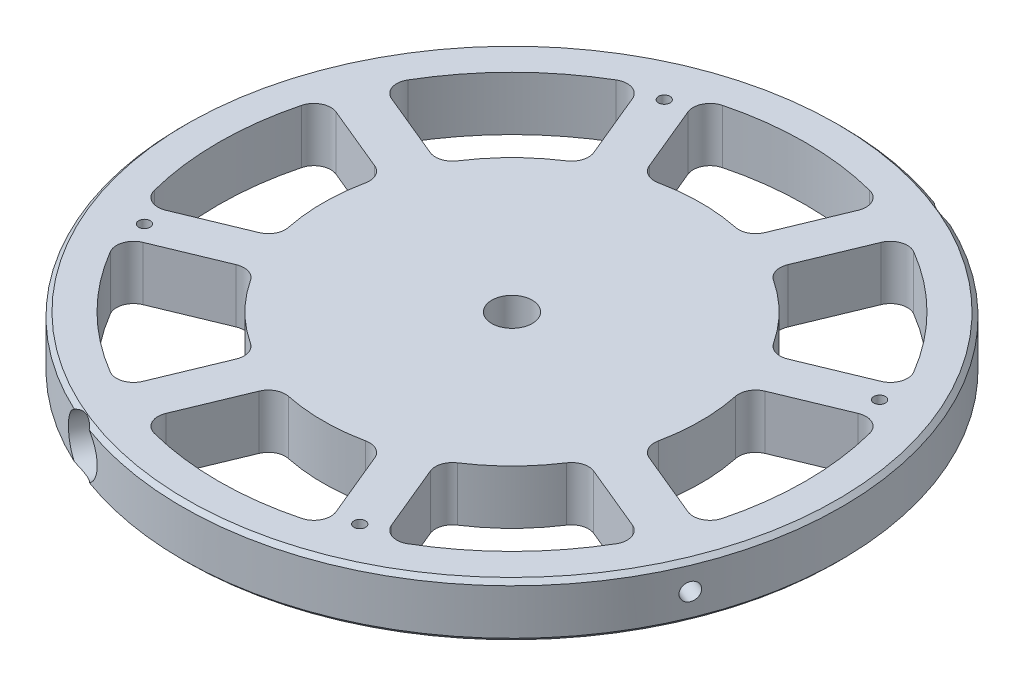
from build123d import *

# Parameters (mm, degrees)
SKETCH2_W                = 77.55
SKETCH2_H                = 12.7
F_6_32_TAPPED_HOLE2_D    = 2.7051
CIRPATTERN3_COUNT        = 4
CUT_EXTRUDE1_DEPTH       = 111.405140279
FILLET1_R                = 4
CIRPATTERN4_COUNT        = 8
FILLET1_OF_CIRPATTERN4_R = 4
CHAMFER1_SIZE            = 1
SKETCH15_W               = 2.0447
SKETCH15_H               = 101.323957926
SKETCH19_R               = 6.25
CUT_EXTRUDE3_DEPTH       = 5
CIRPATTERN5_COUNT        = 2
CIRPATTERN6_COUNT        = 2
SKETCH22_R               = 4.765
CUT_EXTRUDE4_DEPTH       = 12.8


with BuildPart() as part:
    # Sketch2 → Revolve1 (revolve)
    with BuildSketch(Plane(origin=(0, 0, 0), x_dir=(0, 0, -1), z_dir=(1, 0, 0))):
        with Locations((-38.775, 6.35)):
            Rectangle(SKETCH2_W, SKETCH2_H)
    revolve(axis=Axis((0, -0.75, 0), (0, 1, 0)))

    # #6-32 Tapped Hole2 (through all)
    with Locations(Plane(origin=(0, 12.7, 0), x_dir=(1, 0, 0), z_dir=(0, 1, 0))):
        with Locations((-25.333643223, 61.160825052)):
            f_6_32_tapped_hole2 = Hole(F_6_32_TAPPED_HOLE2_D / 2)

    # CirPattern3: #6-32 Tapped Hole2 ×4 about axis
    cirpattern3_axis = Axis((0, -0.75, 0), (0, 1, 0))
    for i in range(1, CIRPATTERN3_COUNT):
        add(f_6_32_tapped_hole2.rotate(cirpattern3_axis, i * 360 / CIRPATTERN3_COUNT), mode=Mode.SUBTRACT)

    # Sketch8 → Cut-Extrude1 (cut, through all)
    with BuildSketch(Plane(origin=(0, 12.7, 0), x_dir=(1, 0, 0), z_dir=(0, 1, 0))):
        with BuildLine():
            Line((-12.282922052, 42.719226653), (-21.735525784, 65.539830782))
            ThreePointArc((-21.735525784, 65.539830782), (0, 69.05), (21.735525784, 65.539830782))
            Line((21.735525784, 65.539830782), (12.282922052, 42.719226653))
            ThreePointArc((12.282922052, 42.719226653), (0, 44.45), (-12.282922052, 42.719226653))
        make_face()
    cut_extrude1 = extrude(amount=-CUT_EXTRUDE1_DEPTH, mode=Mode.SUBTRACT)

    # Fillet1
    fillet1_edges = [part.edges().sort_by_distance(p)[0] for p in [
        (12.282922052, 6.35, -42.719226653),
        (21.735525784, 6.35, -65.539830782),
        (-12.282922052, 6.35, -42.719226653),
        (-21.735525784, 6.35, -65.539830782),
    ]]
    fillet(fillet1_edges, radius=FILLET1_R)

    # CirPattern4: Cut-Extrude1 ×8 about axis
    cirpattern4_axis = Axis((0, -0.75, 0), (0, 1, 0))
    for i in range(1, CIRPATTERN4_COUNT):
        add(cut_extrude1.rotate(cirpattern4_axis, i * 360 / CIRPATTERN4_COUNT), mode=Mode.SUBTRACT)

    # Fillet1 of CirPattern4
    fillet1_of_cirpattern4_edges = [part.edges().sort_by_distance(p)[0] for p in [
        (-21.521717378, 6.35, -38.89239233),
        (-30.974321109, 6.35, -61.712996458),
        (-38.89239233, 6.35, -21.521717378),
        (-61.712996458, 6.35, -30.974321109),
        (-42.719226653, 6.35, -12.282922052),
        (-65.539830782, 6.35, -21.735525784),
        (-42.719226653, 6.35, 12.282922052),
        (-65.539830782, 6.35, 21.735525784),
        (-38.89239233, 6.35, 21.521717378),
        (-61.712996458, 6.35, 30.974321109),
        (-21.521717378, 6.35, 38.89239233),
        (-30.974321109, 6.35, 61.712996458),
        (-12.282922052, 6.35, 42.719226653),
        (-21.735525784, 6.35, 65.539830782),
        (12.282922052, 6.35, 42.719226653),
        (21.735525784, 6.35, 65.539830782),
        (21.521717378, 6.35, 38.89239233),
        (30.974321109, 6.35, 61.712996458),
        (38.89239233, 6.35, 21.521717378),
        (61.712996458, 6.35, 30.974321109),
        (42.719226653, 6.35, 12.282922052),
        (65.539830782, 6.35, 21.735525784),
        (42.719226653, 6.35, -12.282922052),
        (65.539830782, 6.35, -21.735525784),
        (38.89239233, 6.35, -21.521717378),
        (61.712996458, 6.35, -30.974321109),
        (21.521717378, 6.35, -38.89239233),
        (30.974321109, 6.35, -61.712996458),
    ]]
    fillet(fillet1_of_cirpattern4_edges, radius=FILLET1_OF_CIRPATTERN4_R)

    # Chamfer1
    chamfer1_edges = [part.edges().sort_by_distance(p)[0] for p in [
        (0, 0, -77.55),
        (0, 12.7, -77.55),
    ]]
    chamfer(chamfer1_edges, length=CHAMFER1_SIZE)

    # Sketch15 → #20 (0.161) Diameter Hole1 (revolve, cut)
    with BuildSketch(Plane(origin=(0, 6.35, 0), x_dir=(-0.38268343236508734, 0, 0.9238795325112877), z_dir=(0, 1, 0))):
        with Locations((1.02235, 50.661978963)):
            Rectangle(SKETCH15_W, SKETCH15_H)
    revolve(axis=Axis((-5.866635031, 6.35, -2.430039796), (0.9238795325112877, 0, 0.3826834323650874)), mode=Mode.SUBTRACT)

    # Sketch19 → Cut-Extrude3 (cut)
    with BuildSketch(Plane(origin=(29.67710018, 0, -71.646857746), x_dir=(-0.9238795325112891, 0, -0.38268343236508423), z_dir=(0.38268343236508423, 0, -0.9238795325112891))):
        with Locations((0, 6.35)):
            Circle(SKETCH19_R)
    cut_extrude3 = extrude(amount=-CUT_EXTRUDE3_DEPTH, mode=Mode.SUBTRACT)

    # CirPattern5: Cut-Extrude3 ×2 about axis
    cirpattern5_axis = Axis((0, -0.75, 0), (0, 1, 0))
    for i in range(1, CIRPATTERN5_COUNT):
        add(cut_extrude3.rotate(cirpattern5_axis, i * 360 / CIRPATTERN5_COUNT), mode=Mode.SUBTRACT)

    # Sketch21 → #10-24 Tapped Hole1 (revolve, cut)
    with BuildSketch(Plane(origin=(-27.763683018, 6.35, 67.027460084), x_dir=(0.9238795325112891, 0, 0.38268343236508423), z_dir=(0, 1, 0))):
        Polygon((0, 0), (0, 51.940824014), (1.89865, 50.8), (1.89865, 0), align=None)
    f_10_24_tapped_hole1 = revolve(axis=Axis((-30.193722814, 6.35, 72.894095115), (0.38268343236508423, 0, -0.923879532511289)), mode=Mode.SUBTRACT)

    # CirPattern6: #10-24 Tapped Hole1 ×2 about axis
    cirpattern6_axis = Axis((0, -0.75, 0), (0, 1, 0))
    for i in range(1, CIRPATTERN6_COUNT):
        add(f_10_24_tapped_hole1.rotate(cirpattern6_axis, i * 360 / CIRPATTERN6_COUNT), mode=Mode.SUBTRACT)

    # Sketch22 → Cut-Extrude4 (cut)
    with BuildSketch(Plane(origin=(0, 12.7, 0), x_dir=(1, 0, 0), z_dir=(0, 1, 0))):
        Circle(SKETCH22_R)
    extrude(amount=-CUT_EXTRUDE4_DEPTH, mode=Mode.SUBTRACT)


solid = part.part
